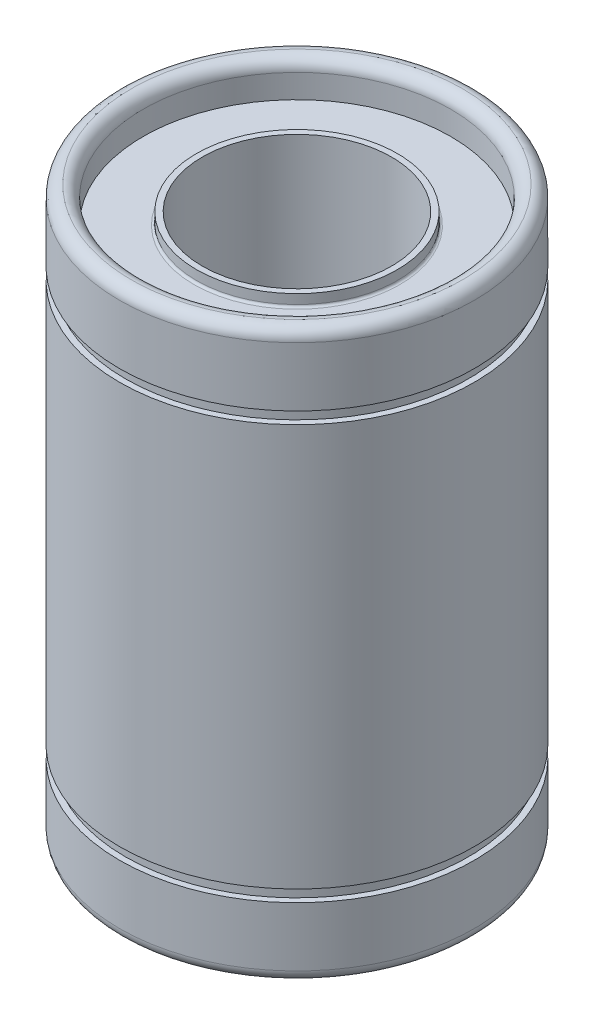
from build123d import *

# Parameters (mm, degrees)
SKETCH2_R           = 6.5
CUT_EXTRUDE1_DEPTH  = 1.5
CUT_EXTRUDE2_START  = -1.5
SKETCH3_R           = 6.5
CUT_EXTRUDE2_DEPTH  = 1.5
SKETCH4_R           = 4
CUT_EXTRUDE3_DEPTH  = 25.874685928
BOSS_EXTRUDE1_START = 0.5
SKETCH5_R           = 4.25
SKETCH5_R_2         = 4
BOSS_EXTRUDE1_DEPTH = 0.5
FILLET2_R           = 0.5
FILLET3_R           = 0.5
FILLET4_R           = 0.1


with BuildPart() as part:
    # Sketch1 → Revolve1 (revolve)
    with BuildSketch(Plane.XY, mode=Mode.PRIVATE) as revolve1_sk:
        Polygon((0, 24), (0, 0), (7.5, 0), (7.5, 3), (7.25, 3), (7.25, 3.5), (7.5, 3.5), (7.5, 20.5), (7.25, 20.5), (7.25, 21), (7.5, 21), (7.5, 24), align=None)
    revolve(revolve1_sk.sketch.rotate(Axis((0, 24, 0), (0, -1, 0)), 90), axis=Axis((0, 24, 0), (0, -1, 0)))

    # Sketch2 → Cut-Extrude1 (cut)
    with BuildSketch(Plane(origin=(0, 24, 0), x_dir=(1, 0, 0), z_dir=(0, 1, 0))):
        with Locations(Location((0, 0, 0), (0, 0, 270))):
            Circle(SKETCH2_R)
    extrude(amount=-CUT_EXTRUDE1_DEPTH, mode=Mode.SUBTRACT)

    # Sketch3 → Cut-Extrude2 (cut)
    with BuildSketch(Plane.XZ.offset(CUT_EXTRUDE2_START)):
        with Locations(Location((0, 0, 0), (0, 0, 90))):
            Circle(SKETCH3_R)
    extrude(amount=CUT_EXTRUDE2_DEPTH, mode=Mode.SUBTRACT)

    # Sketch4 → Cut-Extrude3 (cut, through all)
    with BuildSketch(Plane(origin=(0, 22.5, 0), x_dir=(1, 0, 0), z_dir=(0, 1, 0))):
        with Locations(Location((0, 0, 0), (0, 0, 270))):
            Circle(SKETCH4_R)
    extrude(amount=-CUT_EXTRUDE3_DEPTH, mode=Mode.SUBTRACT)

    # Sketch5 → Boss-Extrude1 (add)
    with BuildSketch(Plane(origin=(0, 22.5, 0), x_dir=(1, 0, 0), z_dir=(0, 1, 0)).offset(BOSS_EXTRUDE1_START)):
        with Locations(Location((0, 0, 0), (0, 0, 270))):
            Circle(SKETCH5_R)
        with Locations(Location((0, 0, 0), (0, 0, 270))):
            Circle(SKETCH5_R_2, mode=Mode.SUBTRACT)
    boss_extrude1 = extrude(amount=-BOSS_EXTRUDE1_DEPTH)

    # Mirror1: Boss-Extrude1 across plane
    add(boss_extrude1.mirror(Plane.ZX.offset(12)))

    # Fillet2
    fillet2_edges = [part.edges().sort_by_distance(p)[0] for p in [
        (0, 24, -7.5),
        (0, 24, -6.5),
    ]]
    fillet(fillet2_edges, radius=FILLET2_R - 0.0001)  # a hair under: the kernel refuses the full size

    # Fillet3
    fillet3_edges = [part.edges().sort_by_distance(p)[0] for p in [
        (0, 0, -7.5),
        (0, 0, -6.5),
    ]]
    fillet(fillet3_edges, radius=FILLET3_R - 0.0001)  # a hair under: the kernel refuses the full size

    # Fillet4
    fillet4_edges = [part.edges().sort_by_distance(p)[0] for p in [
        (0, 22.5, -4.25),
        (0, 1.5, -4.25),
    ]]
    fillet(fillet4_edges, radius=FILLET4_R)


solid = part.part
